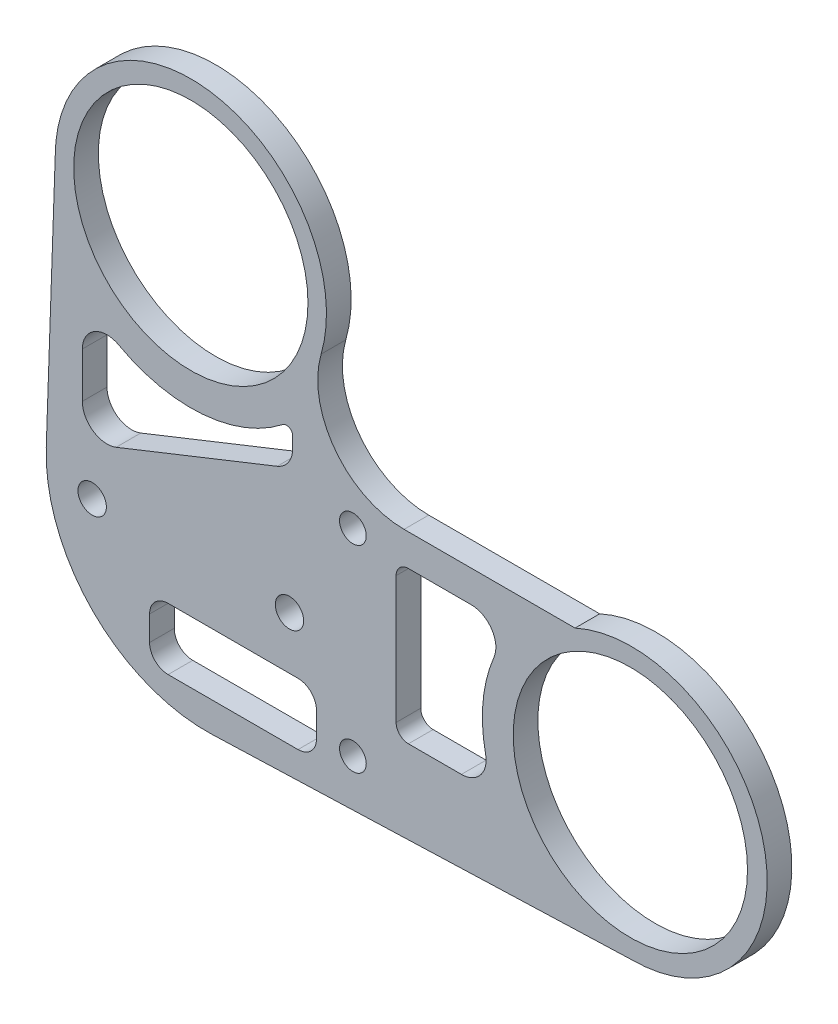
from build123d import *

# Parameters (mm, degrees)
SKETCH_3_R          = 9.5
EXTRUDE_1_DEPTH     = 2
EXTRUDE_START       = -2
EXTRUDE_2_DEPTH     = 2
FILLET_2_R          = 13
SKETCH_5_R          = 1.15
CUT_EXTRUDE_1_DEPTH = 58.948126493
SKETCH_6_R          = 9.5
CUT_EXTRUDE_2_DEPTH = 58.948126493
FILLET_3_R          = 8
FILLET_4_R          = 7
SKETCH_7_R          = 1.08334678
CUT_EXTRUDE_4_DEPTH = 10
CUT_EXTRUDE_5_DEPTH = 10
FILLET_5_R          = 1


with BuildPart() as part:
    # 草图3 → 凸台-拉伸1 (new body)
    with BuildSketch(Plane.XY):
        with BuildLine():
            Line((-11, 0), (-11, -33))
            Line((-11, -33), (35.74, -33))
            ThreePointArc((35.74, -33), (46.48709263, -19.65479212), (31.157424305, -12))
            Line((31.157424305, -12), (9, -12))
            Line((9, -12), (9, -6.32455532))
            ThreePointArc((9, -6.32455532), (3.31662479, 10.488088482), (-11, 0))
        make_face()
        Circle(SKETCH_3_R, mode=Mode.SUBTRACT)
        with Locations((35.74, -22)):
            Circle(SKETCH_3_R, mode=Mode.SUBTRACT)
    extrude(amount=EXTRUDE_1_DEPTH)

    # 草图4 → 凸台-拉伸2 (add)
    with BuildSketch(Plane.XY.offset(2).offset(EXTRUDE_START)):
        with BuildLine():
            Line((35.74, -33), (-12.210859555, -34.674480913))
            Line((-12.210859555, -34.674480913), (-11, 0))
            ThreePointArc((-11, 0), (3.31662479, 10.488088482), (9, -6.32455532))
            Line((9, -6.32455532), (9, -12))
            Line((9, -12), (31.157424305, -12))
            ThreePointArc((31.157424305, -12), (46.48709263, -19.65479212), (35.74, -33))
        make_face()
    extrude(amount=EXTRUDE_2_DEPTH)

    # 圆角2
    fillet_2_edges = [part.edges().sort_by_distance(p)[0] for p in [
        (-12.210859555, -34.674480913, 1),
    ]]
    fillet(fillet_2_edges, radius=FILLET_2_R)

    # 草图5 → 切除-拉伸1 (cut, through all)
    with BuildSketch(Plane.XY.offset(2)):
        with Locations((-8, -22.5)):
            Circle(SKETCH_5_R)
        with Locations((8, -22.5)):
            Circle(SKETCH_5_R)
    extrude(amount=-CUT_EXTRUDE_1_DEPTH, mode=Mode.SUBTRACT)

    # 草图6 → 切除-拉伸2 (cut, through all)
    with BuildSketch(Plane.XY.offset(2)):
        Circle(SKETCH_6_R)
        with Locations((35.642814002, -22)):
            Circle(SKETCH_6_R)
    extrude(amount=-CUT_EXTRUDE_2_DEPTH, mode=Mode.SUBTRACT)

    # 圆角3
    # the kernel refuses this fillet: 8 mm, written as the material it adds along each edge
    with BuildSketch(Plane(origin=(9, -12, 0), x_dir=(0, 1, 0), z_dir=(0, 0, 1))) as fillet_3_piece_1:
        with BuildLine():
            CenterArc((8, -7.654831322), FILLET_3_R, 106.89204914, 73.10795086)
            Line((0, -7.654831322), (-0.16, -7.654831322))
            Line((-0.16, -7.654831322), (-0.16, 0))
            Line((-0.16, 0), (0, 0.16))
            ThreePointArc((0, 0.16), (2.83772234, 0.16), (5.628953573, 0.153096626))
            Line((5.628953573, 0.153096626), (5.67544468, 0))
        make_face()
    extrude(amount=2)

    # 圆角4
    fillet_4_edges = [part.edges().sort_by_distance(p)[0] for p in [
        (9, -6.32455532, 1),
    ]]
    fillet(fillet_4_edges, radius=FILLET_4_R)

    # 草图7 → 切除-拉伸4 (cut)
    with BuildSketch(Plane.XY.offset(2)):
        with Locations((13.142814002, -14)):
            Circle(SKETCH_7_R)
        with Locations((13.142814002, -30)):
            Circle(SKETCH_7_R)
    extrude(amount=-CUT_EXTRUDE_4_DEPTH, mode=Mode.SUBTRACT)

    # 草图8 → 切除-拉伸5 (cut)
    with BuildSketch(Plane.XY.offset(2)):
        with BuildLine():
            Line((16.646480101, -26.883817545), (16.646480101, -14.57255416))
            Line((16.646480101, -14.57255416), (22.737666516, -14.57255416))
            ThreePointArc((22.737666516, -14.57255416), (24.403604511, -15.465914835), (24.581259014, -17.347903565))
            ThreePointArc((24.581259014, -17.347903565), (23.697285572, -20.857918339), (23.900157183, -24.47184361))
            ThreePointArc((23.900157183, -24.47184361), (23.496100815, -26.143986607), (21.943047713, -26.883817545))
            Line((21.943047713, -26.883817545), (16.646480101, -26.883817545))
        make_face()
        with BuildLine():
            Line((-1.844212644, -26.7628803), (8.691309214, -26.7628803))
            ThreePointArc((8.691309214, -26.7628803), (9.751969386, -27.202220128), (10.191309214, -28.2628803))
            Line((10.191309214, -28.2628803), (10.191309214, -30.26653293))
            ThreePointArc((10.191309214, -30.26653293), (9.751969386, -31.327193102), (8.691309214, -31.76653293))
            Line((8.691309214, -31.76653293), (-1.844212644, -31.76653293))
            ThreePointArc((-1.844212644, -31.76653293), (-2.904872816, -31.327193102), (-3.344212644, -30.26653293))
            Line((-3.344212644, -30.26653293), (-3.344212644, -28.2628803))
            ThreePointArc((-3.344212644, -28.2628803), (-2.904872816, -27.202220128), (-1.844212644, -26.7628803))
        make_face()
        with BuildLine():
            Line((-8.796911022, -16.052867786), (-8.796911022, -12.380312846))
            ThreePointArc((-8.796911022, -12.380312846), (-7.815486406, -10.659120182), (-5.834406834, -10.627148368))
            ThreePointArc((-5.834406834, -10.627148368), (0.968228408, -12.084664633), (7.452020697, -9.562634212))
            ThreePointArc((7.452020697, -9.562634212), (7.978826228, -9.507761331), (8.259361329, -9.957022011))
            Line((8.259361329, -9.957022011), (8.259361329, -10.859557769))
            ThreePointArc((8.259361329, -10.859557769), (7.914413338, -11.982412545), (6.99855848, -12.717940822))
            Line((6.99855848, -12.717940822), (-6.057713871, -17.911250839))
            ThreePointArc((-6.057713871, -17.911250839), (-7.919765799, -17.707919794), (-8.796911022, -16.052867786))
        make_face()
    extrude(amount=-CUT_EXTRUDE_5_DEPTH, mode=Mode.SUBTRACT)

    # 圆角5
    fillet_5_edges = [part.edges().sort_by_distance(p)[0] for p in [
        (16.646480101, -26.883817545, 1),
        (16.646480101, -14.57255416, 1),
    ]]
    fillet(fillet_5_edges, radius=FILLET_5_R)


solid = part.part
